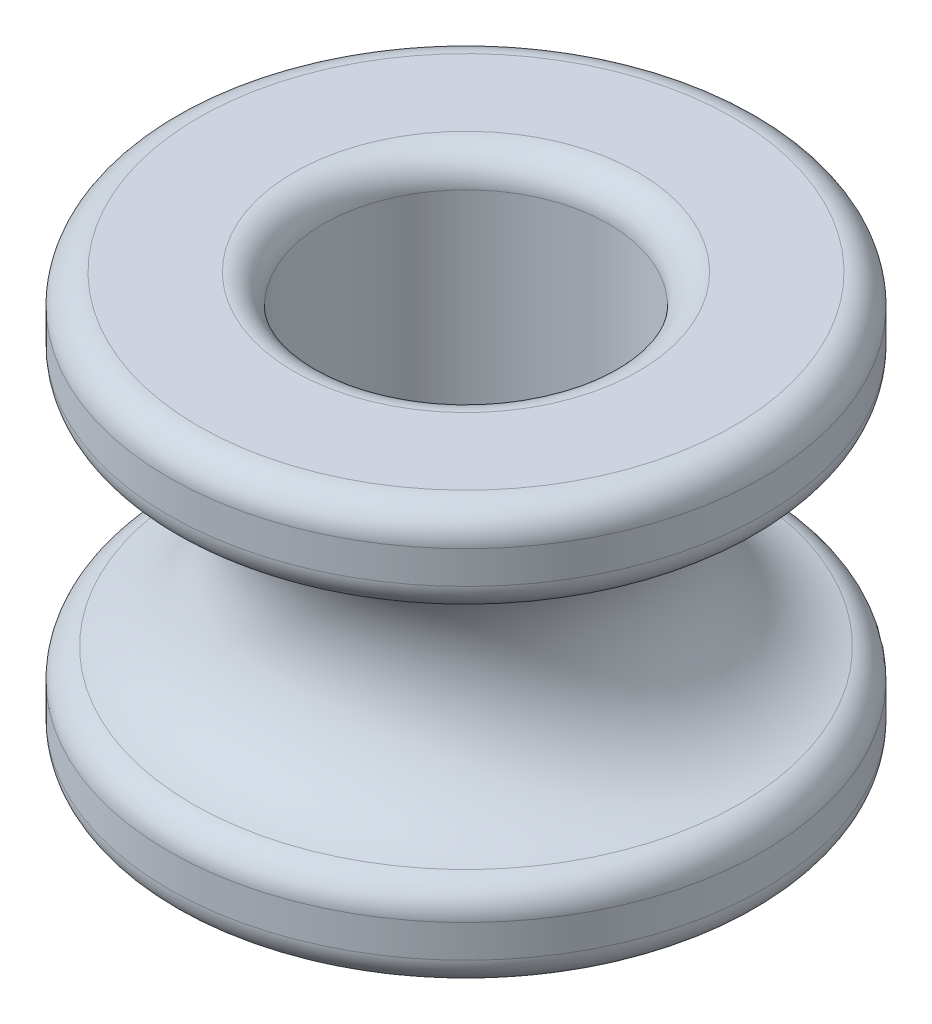
from build123d import *

# Parameters (mm, degrees)
FILLET1_R = 0.5


with BuildPart() as part:
    # Sketch1 → Revolve1 (revolve)
    with BuildSketch(Plane.XY):
        with BuildLine():
            Line((1.2, 3.5), (1.2, -3.5))
            Line((1.2, -3.5), (3.8, -3.5))
            Line((3.8, -3.5), (3.8, -2))
            ThreePointArc((3.8, -2), (1.8, 0), (3.8, 2))
            Line((3.8, 2), (3.8, 3.5))
            Line((3.8, 3.5), (1.2, 3.5))
        make_face()
    revolve(axis=Axis((-1.2, -3.5, 0), (0, 1, 0)))

    # Fillet1
    fillet1_edges = [part.edges().sort_by_distance(p)[0] for p in [
        (-3.6, -3.5, 0),
        (-6.2, -3.5, 0),
        (-6.2, -2, 0),
        (-3.6, 3.5, 0),
        (-6.2, 3.5, 0),
        (-6.2, 2, 0),
    ]]
    fillet(fillet1_edges, radius=FILLET1_R)


solid = part.part
